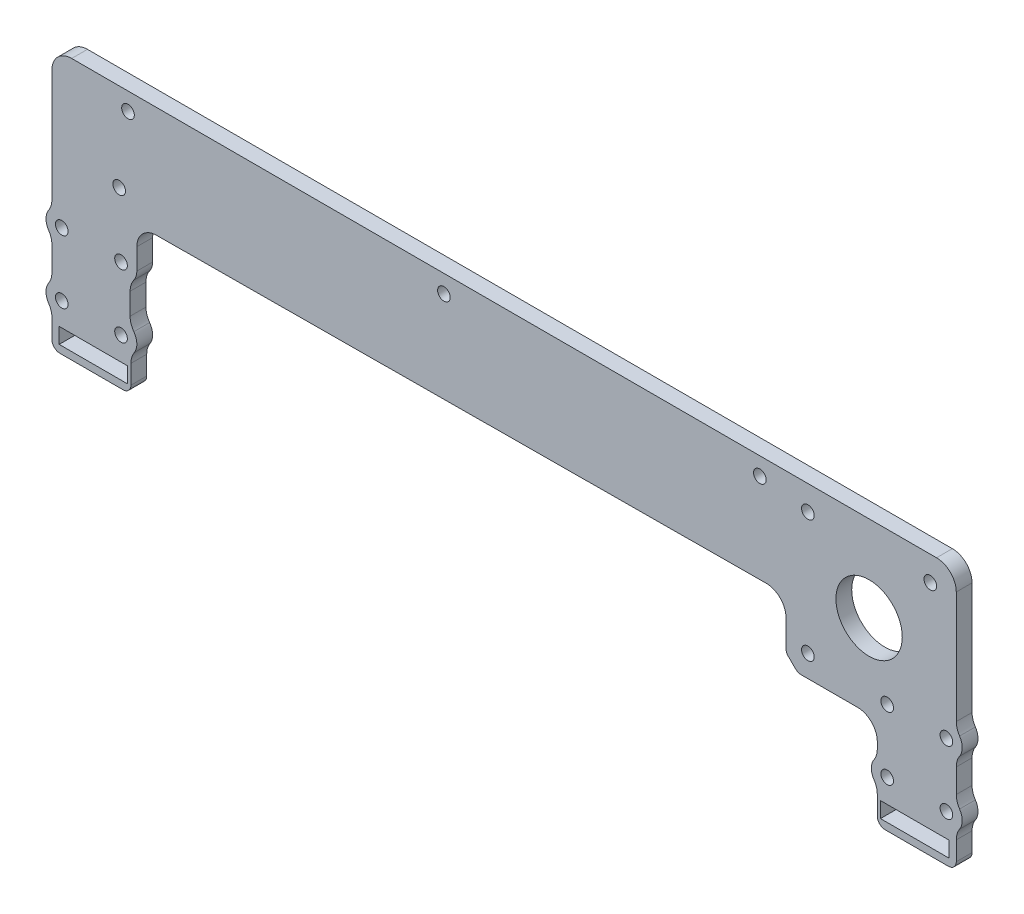
from build123d import *

# Parameters (mm, degrees)
RESSALTO_EXTRUS_O1_DEPTH = 4
M3_CLEARANCE_HOLE2_D     = 3.2
ESBO_O7_R                = 8.4
CORTE_EXTRUS_O1_DEPTH    = 10
M3_CLEARANCE_HOLE1_D     = 3.2
M3_CLEARANCE_HOLE3_D     = 3.2
FILETE1_R                = 5
M3_CLEARANCE_HOLE5_D     = 3.2
FILETE2_R                = 2
ESBO_O16_W               = 17.35833251
ESBO_O16_H               = 3.95
ESBO_O16_W_2             = 17.358332509
CUT_EXTRUDE1_DEPTH       = 4
FILLET2_R                = 5


with BuildPart() as part:
    # Esboço1 → Ressalto-extrusão1 (new body)
    with BuildSketch(Plane.XY):
        with BuildLine():
            Line((-95.048931647, 18.252242094), (-95.048931647, 26.894793301))
            ThreePointArc((-95.048931647, 26.894793301), (-93.550886325, 30.142326699), (-95.248931647, 33.289905934))
            Line((-95.248931647, 33.289905934), (-95.248931647, 42.744678666))
            ThreePointArc((-95.248931647, 42.744678666), (-93.999283778, 44.173383409), (-93.548931647, 46.0172923))
            Line((-93.548931647, 46.0172923), (-93.548931647, 56.342842726))
            Line((-93.548931647, 56.342842726), (70.826556743, 57.286376167))
            Line((70.826556743, 57.286376167), (70.826556743, 44.612292304))
            Line((70.826556743, 44.612292304), (73.826556743, 41.612292304))
            Line((73.826556743, 41.612292304), (93.954781763, 41.612292304))
            Line((93.954781763, 41.612292304), (93.954781763, 33.139791299))
            ThreePointArc((93.954781763, 33.139791299), (92.454781763, 30.0172923), (93.954781763, 26.894793301))
            Line((93.954781763, 26.894793301), (93.954781763, 18.252242094))
            Line((93.954781763, 18.252242094), (113.954781763, 18.252242094))
            Line((113.954781763, 18.252242094), (113.954781763, 26.894793301))
            ThreePointArc((113.954781763, 26.894793301), (115.454781763, 30.0172923), (113.954781763, 33.139791299))
            Line((113.954781763, 33.139791299), (113.954781763, 42.894793301))
            ThreePointArc((113.954781763, 42.894793301), (115.454781763, 46.0172923), (113.954781763, 49.139791299))
            Line((113.954781763, 49.139791299), (113.954781763, 84.40808297))
            Line((113.954781763, 84.40808297), (-115.048931647, 84.40808297))
            Line((-115.048931647, 84.40808297), (-115.048931647, 49.139791299))
            ThreePointArc((-115.048931647, 49.139791299), (-116.548931647, 46.0172923), (-115.048931647, 42.894793301))
            Line((-115.048931647, 42.894793301), (-115.048931647, 33.139791299))
            ThreePointArc((-115.048931647, 33.139791299), (-116.548931647, 30.0172923), (-115.048931647, 26.894793301))
            Line((-115.048931647, 26.894793301), (-115.048931647, 18.252242094))
            Line((-115.048931647, 18.252242094), (-95.048931647, 18.252242094))
        make_face()
    extrude(amount=RESSALTO_EXTRUS_O1_DEPTH)

    # M3 Clearance Hole2 (through all)
    with Locations(Plane.XY.offset(4)):
        with Locations((-112.548931647, 46.0172923), (-112.548931647, 30.0172923), (-97.548931647, 30.0172923), (-97.548931647, 46.0172923), (96.454781763, 30.0172923), (111.454781763, 30.0172923), (111.454781763, 46.06544156), (96.454781763, 46.0172923)):
            Hole(M3_CLEARANCE_HOLE2_D / 2)

    # Esboço7 → Corte-extrusão1 (cut)
    with BuildSketch(Plane(origin=(0, 0, 0), x_dir=(-1, 0, 0), z_dir=(0, 0, -1))):
        with Locations((-91.876556743, 62.662292304)):
            Circle(ESBO_O7_R)
    extrude(amount=-CORTE_EXTRUS_O1_DEPTH, mode=Mode.SUBTRACT)

    # M3 Clearance Hole1 (through all)
    with Locations(Plane(origin=(0, 0, 0), x_dir=(-1, 0, 0), z_dir=(0, 0, -1))):
        with Locations((98.016827352, 62.117292304)):
            Hole(M3_CLEARANCE_HOLE1_D / 2)

    # M3 Clearance Hole3 (through all)
    with Locations(Plane(origin=(0, 0, 0), x_dir=(-1, 0, 0), z_dir=(0, 0, -1))):
        with Locations((-76.376556743, 47.162292304), (-76.376556743, 78.162292304), (-107.376556743, 78.162292304)):
            Hole(M3_CLEARANCE_HOLE3_D / 2)

    # Filete1
    filete1_edges = [part.edges().sort_by_distance(p)[0] for p in [
        (-95.048931647, 26.894793301, 2),
        (-95.248931647, 33.289905934, 2),
        (-115.048931647, 26.894793301, 2),
        (-115.048931647, 33.139791299, 2),
        (-115.048931647, 42.894793301, 2),
        (-115.048931647, 49.139791299, 2),
        (93.954781763, 26.894793301, 2),
        (93.954781763, 33.139791299, 2),
        (113.954781763, 26.894793301, 2),
        (113.954781763, 33.139791299, 2),
        (113.954781763, 49.139791299, 2),
        (113.954781763, 42.894793301, 2),
        (93.954781763, 41.612292304, 2),
        (70.826556743, 57.286376167, 2),
        (-115.048931647, 84.40808297, 2),
        (113.954781763, 84.40808297, 2),
        (-95.248931647, 42.744678666, 2),
    ]]
    fillet(filete1_edges, radius=FILETE1_R)

    # M3 Clearance Hole5 (through all)
    with Locations(Plane.XY.offset(4)):
        with Locations((-95.783895796, 79.917292304), (64.216104204, 79.917292304), (-15.783895796, 79.917292304)):
            Hole(M3_CLEARANCE_HOLE5_D / 2)

    # Filete2
    filete2_edges = [part.edges().sort_by_distance(p)[0] for p in [
        (-95.048931647, 18.252242094, 2),
        (-115.048931647, 18.252242094, 2),
        (113.954781763, 18.252242094, 2),
        (93.954781763, 18.252242094, 2),
        (73.826556743, 41.612292304, 2),
        (70.826556743, 44.612292304, 2),
    ]]
    fillet(filete2_edges, radius=FILETE2_R)

    # Esboço16 → Cut-Extrude1 (cut)
    with BuildSketch(Plane.XY.offset(4)):
        with Locations((-104.531590398, 22.092946092)):
            Rectangle(ESBO_O16_W, ESBO_O16_H)
        with Locations((103.437440514, 22.092946092)):
            Rectangle(ESBO_O16_W_2, ESBO_O16_H)
    extrude(amount=-CUT_EXTRUDE1_DEPTH, mode=Mode.SUBTRACT)

    # Fillet2
    fillet2_edges = [part.edges().sort_by_distance(p)[0] for p in [
        (-93.548931647, 56.342842726, 2),
    ]]
    fillet(fillet2_edges, radius=FILLET2_R)


solid = part.part
